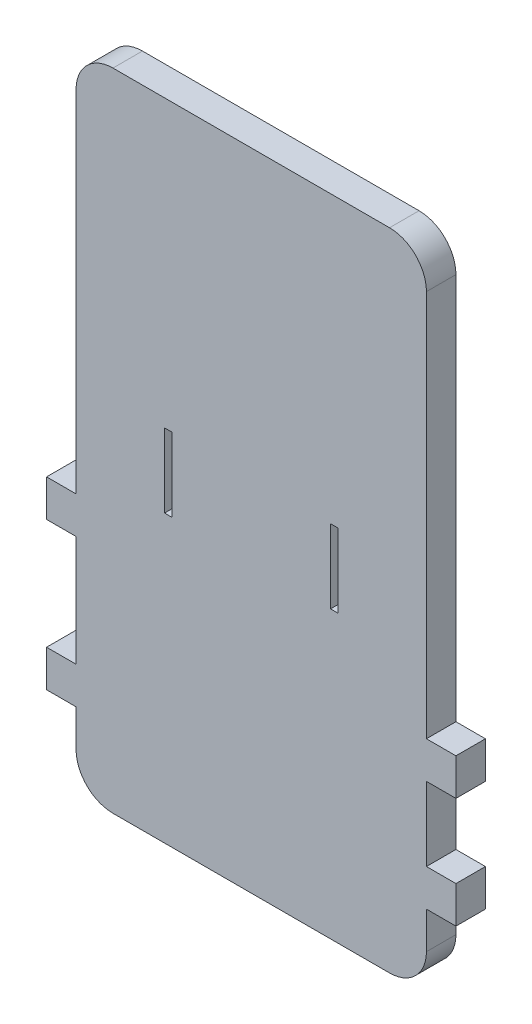
from build123d import *

# Parameters (mm, degrees)
SKETCH1_W           = 2
SKETCH1_H           = 20
BOSS_EXTRUDE1_DEPTH = 8
SKETCH3_W           = 8
SKETCH3_H           = 10
BOSS_EXTRUDE2_DEPTH = 8
SKETCH4_W           = 8
SKETCH4_H           = 10
BOSS_EXTRUDE3_DEPTH = 8


with BuildPart() as part:
    # Sketch1 → Boss-Extrude1 (new body)
    with BuildSketch(Plane.XY):
        with BuildLine():
            ThreePointArc((-47.5, -77.5), (-44.571067812, -84.571067812), (-37.5, -87.5))
            Line((-37.5, -87.5), (37.5, -87.5))
            ThreePointArc((37.5, -87.5), (44.571067812, -84.571067812), (47.5, -77.5))
            Line((47.5, -77.5), (47.5, 77.5))
            ThreePointArc((47.5, 77.5), (44.571067812, 84.571067812), (37.5, 87.5))
            Line((37.5, 87.5), (-37.5, 87.5))
            ThreePointArc((-37.5, 87.5), (-44.571067812, 84.571067812), (-47.5, 77.5))
            Line((-47.5, 77.5), (-47.5, -77.5))
        make_face()
        with Locations((-22.5, 0)):
            Rectangle(SKETCH1_W, SKETCH1_H, mode=Mode.SUBTRACT)
        with Locations((22.5, 0)):
            Rectangle(SKETCH1_W, SKETCH1_H, mode=Mode.SUBTRACT)
    extrude(amount=BOSS_EXTRUDE1_DEPTH)

    # Sketch3 → Boss-Extrude2 (add)
    with BuildSketch(Plane.ZY.offset(47.5)):
        with Locations((4, -62.5)):
            Rectangle(SKETCH3_W, SKETCH3_H)
        with Locations((4, -22.5)):
            Rectangle(SKETCH3_W, SKETCH3_H)
    extrude(amount=BOSS_EXTRUDE2_DEPTH)

    # Sketch4 → Boss-Extrude3 (add)
    with BuildSketch(Plane(origin=(47.5, 0, 0), x_dir=(0, 0, -1), z_dir=(1, 0, 0))):
        with Locations((-4, -62.5)):
            Rectangle(SKETCH4_W, SKETCH4_H)
        with Locations((-4, -32.5)):
            Rectangle(SKETCH4_W, SKETCH4_H)
    extrude(amount=BOSS_EXTRUDE3_DEPTH)


solid = part.part
